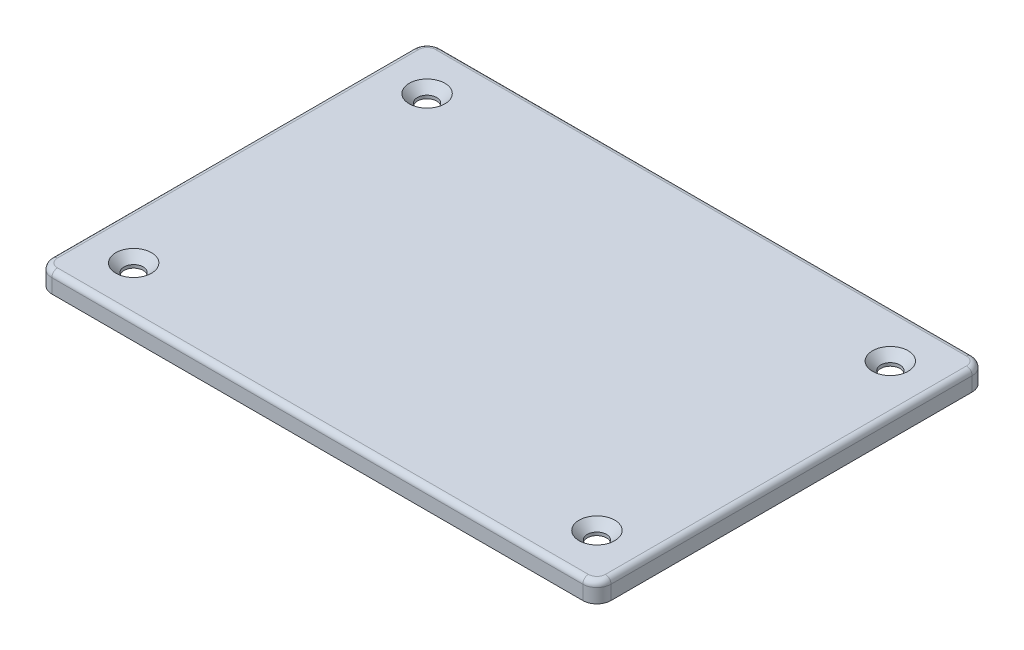
from build123d import *

# Parameters (mm, degrees)
SKETCH2_W                                           = 98.778145
SKETCH2_H                                           = 68.778145
BOSS_EXTRUDE1_DEPTH                                 = 3.5
FILLET1_R                                           = 1
FILLET2_R                                           = 2.5
CUT_EXTRUDE1_DEPTH                                  = 1.5
CSK_FOR_M3_COUNTERSUNK_FLAT_HEAD_SCREW1_D           = 3.4
CSK_FOR_M3_COUNTERSUNK_FLAT_HEAD_SCREW1_DEPTH       = 10
CSK_FOR_M3_COUNTERSUNK_FLAT_HEAD_SCREW1_CSINK_D     = 6.3
CSK_FOR_M3_COUNTERSUNK_FLAT_HEAD_SCREW1_CSINK_ANGLE = 90
CSK_FOR_M3_COUNTERSUNK_FLAT_HEAD_SCREW1_TIP         = 1.021463052


with BuildPart() as part:
    # Sketch2 → Boss-Extrude1 (new body)
    with BuildSketch(Plane(origin=(0, 0, 0), x_dir=(1, 0, 0), z_dir=(0, 1, 0))):
        Rectangle(SKETCH2_W, SKETCH2_H)
    extrude(amount=BOSS_EXTRUDE1_DEPTH)

    # Fillet1
    fillet1_edges = [part.edges().sort_by_distance(p)[0] for p in [
        (49.3890725, 3.5, 0),
        (0, 3.5, -34.3890725),
        (-49.3890725, 3.5, 0),
        (0, 3.5, 34.3890725),
    ]]
    fillet(fillet1_edges, radius=FILLET1_R)

    # Fillet2
    # the kernel refuses this fillet: 2.5 mm, written as the material it takes off along each edge
    with BuildSketch(Plane(origin=(46.8890725, 3.5, 31.8890725), x_dir=(0, 0, 1), z_dir=(-1, 0, 0))) as fillet2_piece_1:
        with BuildLine():
            CenterArc((1.5, -1), 1, 0, 90)
            Line((2.5, -1), (2.5, 0))
            Line((2.5, 0), (1.5, 0))
        make_face()
    revolve(axis=Axis((46.8890725, 3.5, 31.8890725), (0, 1, 0)), revolution_arc=90, mode=Mode.SUBTRACT)
    with BuildSketch(Plane(origin=(-46.8890725, 3.5, 31.8890725), x_dir=(-1, 0, 0), z_dir=(0, 0, -1))) as fillet2_piece_2:
        with BuildLine():
            CenterArc((1.5, -1), 1, 0, 90)
            Line((2.5, -1), (2.5, 0))
            Line((2.5, 0), (1.5, 0))
        make_face()
    revolve(axis=Axis((-46.8890725, 3.5, 31.8890725), (0, 1, 0)), revolution_arc=90, mode=Mode.SUBTRACT)
    with BuildSketch(Plane(origin=(46.8890725, 3.5, -31.8890725), x_dir=(1, 0, 0), z_dir=(0, 0, 1))) as fillet2_piece_3:
        with BuildLine():
            CenterArc((1.5, -1), 1, 0, 90)
            Line((2.5, -1), (2.5, 0))
            Line((2.5, 0), (1.5, 0))
        make_face()
    revolve(axis=Axis((46.8890725, 3.5, -31.8890725), (0, 1, 0)), revolution_arc=90, mode=Mode.SUBTRACT)
    with BuildSketch(Plane(origin=(-46.8890725, 3.5, -31.8890725), x_dir=(0, 0, -1), z_dir=(1, 0, 0))) as fillet2_piece_4:
        with BuildLine():
            CenterArc((1.5, -1), 1, 0, 90)
            Line((2.5, -1), (2.5, 0))
            Line((2.5, 0), (1.5, 0))
        make_face()
    revolve(axis=Axis((-46.8890725, 3.5, -31.8890725), (0, 1, 0)), revolution_arc=90, mode=Mode.SUBTRACT)
    with BuildSketch(Plane(origin=(-49.3890725, -6.25, -34.3890725), x_dir=(0, 0, 1), z_dir=(0, 1, 0)), Plane(origin=(-49.3890725, -6.25, 34.3890725), x_dir=(1, 0, 0), z_dir=(0, 1, 0))) as fillet2_piece_5:
        with BuildLine():
            CenterArc((FILLET2_R, FILLET2_R), FILLET2_R, 180, 90)
            Line((0, FILLET2_R), (0, 0))
            Line((0, 0), (FILLET2_R, 0))
        make_face()
    extrude(amount=9.75, mode=Mode.SUBTRACT)
    with BuildSketch(Plane(origin=(49.3890725, -6.25, -34.3890725), x_dir=(0, 0, 1), z_dir=(0, 1, 0)), Plane(origin=(49.3890725, -6.25, 34.3890725), x_dir=(-1, 0, 0), z_dir=(0, 1, 0))) as fillet2_piece_6:
        with BuildLine():
            CenterArc((FILLET2_R, -FILLET2_R), FILLET2_R, 90, 90)
            Line((0, -FILLET2_R), (0, 0))
            Line((0, 0), (FILLET2_R, 0))
        make_face()
    extrude(amount=9.75, mode=Mode.SUBTRACT)

    # Sketch3 → Cut-Extrude1 (cut)
    with BuildSketch(Plane.XZ):
        with BuildLine():
            Line((47.8890725, -31.8890725), (47.8890725, 31.8890725))
            ThreePointArc((47.8890725, 31.8890725), (47.596179281, 32.596179281), (46.8890725, 32.8890725))
            Line((46.8890725, 32.8890725), (-46.8890725, 32.8890725))
            ThreePointArc((-46.8890725, 32.8890725), (-47.596179281, 32.596179281), (-47.8890725, 31.8890725))
            Line((-47.8890725, 31.8890725), (-47.8890725, -31.8890725))
            ThreePointArc((-47.8890725, -31.8890725), (-47.596179281, -32.596179281), (-46.8890725, -32.8890725))
            Line((-46.8890725, -32.8890725), (46.8890725, -32.8890725))
            ThreePointArc((46.8890725, -32.8890725), (47.596179281, -32.596179281), (47.8890725, -31.8890725))
        make_face()
    extrude(amount=-CUT_EXTRUDE1_DEPTH, mode=Mode.SUBTRACT)

    # CSK for M3 Countersunk Flat Head Screw1
    with Locations(Plane(origin=(-40.911963263, 3.5, -25.911963263), x_dir=(0, 0, 1), z_dir=(0, 1, 0))):
        with Locations((0, 0), (0, 81.823926071), (51.823926071, 81.823926071), (51.823926071, 0)):
            CounterSinkHole(CSK_FOR_M3_COUNTERSUNK_FLAT_HEAD_SCREW1_D / 2, CSK_FOR_M3_COUNTERSUNK_FLAT_HEAD_SCREW1_CSINK_D / 2, depth=CSK_FOR_M3_COUNTERSUNK_FLAT_HEAD_SCREW1_DEPTH, counter_sink_angle=CSK_FOR_M3_COUNTERSUNK_FLAT_HEAD_SCREW1_CSINK_ANGLE)
            with Locations((0, 0, -(CSK_FOR_M3_COUNTERSUNK_FLAT_HEAD_SCREW1_DEPTH + CSK_FOR_M3_COUNTERSUNK_FLAT_HEAD_SCREW1_TIP / 2))):  # 118° drill point
                Cone(0, CSK_FOR_M3_COUNTERSUNK_FLAT_HEAD_SCREW1_D / 2, CSK_FOR_M3_COUNTERSUNK_FLAT_HEAD_SCREW1_TIP, mode=Mode.SUBTRACT)


solid = part.part
